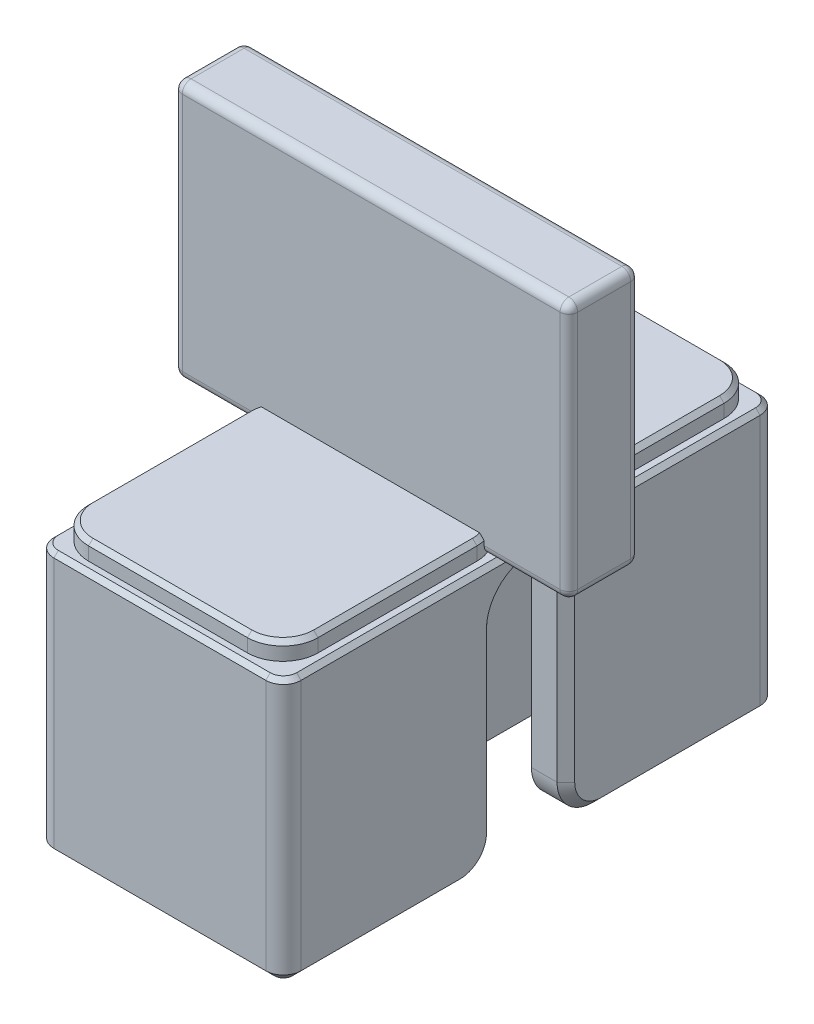
from build123d import *

# Parameters (mm, degrees)
SKETCH1_W             = 112
SKETCH1_H             = 20
BOSS_EXTRUDE1_DEPTH   = 73
FILLET1_R             = 2.5
BOSS_EXTRUDE5_DEPTH   = 5
BOSS_EXTRUDE5_2_DEPTH = 5
BOSS_EXTRUDE9_DEPTH   = 5
SKETCH10_W            = 22.5
SKETCH10_H            = 111
BOSS_EXTRUDE10_DEPTH  = 70
CUT_EXTRUDE1_DEPTH    = 70
FILLET14_R            = 10
FILLET15_R            = 10
CHAMFER1_SIZE         = 2.5
CHAMFER2_SIZE         = 1.25
CUT_EXTRUDE2_DEPTH    = 70
CUT_EXTRUDE3_DEPTH    = 70
CHAMFER3_SIZE         = 1.25


with BuildPart() as part:
    # Sketch1 → Boss-Extrude1 (new body)
    with BuildSketch(Plane(origin=(0, 0, 0), x_dir=(1, 0, 0), z_dir=(0, 1, 0))):
        Rectangle(SKETCH1_W, SKETCH1_H)
    extrude(amount=BOSS_EXTRUDE1_DEPTH)

    # Fillet1
    fillet1_edges = [part.edges().sort_by_distance(p)[0] for p in [
        (-56, 73, 0),
        (0, 73, 10),
        (56, 73, 0),
        (0, 0, 10),
        (-56, 0, 0),
        (0, 0, -10),
        (56, 0, 0),
        (56, 36.5, 10),
        (-56, 36.5, 10),
        (-56, 36.5, -10),
        (56, 36.5, -10),
        (0, 73, -10),
    ]]
    fillet(fillet1_edges, radius=FILLET1_R)


with BuildPart() as body_2:
    # Sketch7 → Boss-Extrude5 (new body)
    with BuildSketch(Plane(origin=(0, 0, 0), x_dir=(1, 0, 0), z_dir=(0, 1, 0))):
        with BuildLine():
            Line((32.297324425, -57.33785954), (32.297324425, -12.33785954))
            ThreePointArc((32.297324425, -12.33785954), (29.368392237, -5.266791728), (22.297324425, -2.33785954))
            Line((22.297324425, -2.33785954), (-22.702675575, -2.33785954))
            ThreePointArc((-22.702675575, -2.33785954), (-29.773743387, -5.266791728), (-32.702675575, -12.33785954))
            Line((-32.702675575, -12.33785954), (-32.702675575, -57.33785954))
            ThreePointArc((-32.702675575, -57.33785954), (-29.773743387, -64.408927352), (-22.702675575, -67.33785954))
            Line((-22.702675575, -67.33785954), (22.297324425, -67.33785954))
            ThreePointArc((22.297324425, -67.33785954), (29.368392237, -64.408927352), (32.297324425, -57.33785954))
        make_face()
    extrude(amount=BOSS_EXTRUDE5_DEPTH)


with BuildPart() as body_3:
    # Sketch7 → Boss-Extrude5 2 (new body)
    with BuildSketch(Plane(origin=(0, 0, 0), x_dir=(1, 0, 0), z_dir=(0, 1, 0))):
        with BuildLine():
            Line((-32.702675575, 57.66214046), (-32.702675575, 12.66214046))
            ThreePointArc((-32.702675575, 12.66214046), (-29.773743387, 5.591072648), (-22.702675575, 2.66214046))
            Line((-22.702675575, 2.66214046), (22.297324425, 2.66214046))
            ThreePointArc((22.297324425, 2.66214046), (29.368392237, 5.591072648), (32.297324425, 12.66214046))
            Line((32.297324425, 12.66214046), (32.297324425, 57.66214046))
            ThreePointArc((32.297324425, 57.66214046), (29.368392237, 64.733208272), (22.297324425, 67.66214046))
            Line((22.297324425, 67.66214046), (-22.702675575, 67.66214046))
            ThreePointArc((-22.702675575, 67.66214046), (-29.773743387, 64.733208272), (-32.702675575, 57.66214046))
        make_face()
    extrude(amount=BOSS_EXTRUDE5_2_DEPTH)


    add(body_2.part)  # Boss-Extrude9 merges body 2
    # Sketch9 → Boss-Extrude9 (add)
    with BuildSketch(Plane.XZ):
        with BuildLine():
            Line((-29.633608546, 70.217237559), (30.366391454, 70.217237559))
            ThreePointArc((30.366391454, 70.217237559), (33.90192536, 68.752771465), (35.366391454, 65.217237559))
            Line((35.366391454, 65.217237559), (35.366391454, -64.782762441))
            ThreePointArc((35.366391454, -64.782762441), (33.90192536, -68.318296346), (30.366391454, -69.782762441))
            Line((30.366391454, -69.782762441), (-29.633608546, -69.782762441))
            ThreePointArc((-29.633608546, -69.782762441), (-33.169142452, -68.318296346), (-34.633608546, -64.782762441))
            Line((-34.633608546, -64.782762441), (-34.633608546, 65.217237559))
            ThreePointArc((-34.633608546, 65.217237559), (-33.169142452, 68.752771465), (-29.633608546, 70.217237559))
        make_face()
    extrude(amount=BOSS_EXTRUDE9_DEPTH)

    # Sketch10 → Boss-Extrude10 (add)
    with BuildSketch(Plane.XZ.offset(5)):
        with BuildLine():
            Line((-34.633608546, 65.217237559), (-34.633608546, -64.782762441))
            ThreePointArc((-34.633608546, -64.782762441), (-33.169142452, -68.318296346), (-29.633608546, -69.782762441))
            Line((-29.633608546, -69.782762441), (30.366391454, -69.782762441))
            ThreePointArc((30.366391454, -69.782762441), (33.90192536, -68.318296346), (35.366391454, -64.782762441))
            Line((35.366391454, -64.782762441), (35.366391454, 65.217237559))
            ThreePointArc((35.366391454, 65.217237559), (33.90192536, 68.752771465), (30.366391454, 70.217237559))
            Line((30.366391454, 70.217237559), (-29.633608546, 70.217237559))
            ThreePointArc((-29.633608546, 70.217237559), (-33.169142452, 68.752771465), (-34.633608546, 65.217237559))
        make_face()
        with Locations((14.116391454, 0)):
            Rectangle(SKETCH10_W, SKETCH10_H, mode=Mode.SUBTRACT)
        with Locations((-14.116391454, 0)):
            Rectangle(SKETCH10_W, SKETCH10_H, mode=Mode.SUBTRACT)
    extrude(amount=BOSS_EXTRUDE10_DEPTH)

    # Sketch11 → Cut-Extrude1 (cut)
    with BuildSketch(Plane.ZY.offset(34.633608546)):
        Polygon((0.217237559, -5), (-9.782762441, -5), (-9.782762441, -75), (10.217237559, -75), (10.217237559, -5), align=None)
    extrude(amount=-CUT_EXTRUDE1_DEPTH, mode=Mode.SUBTRACT)

    # Fillet14
    fillet14_edges = [body_3.edges().sort_by_distance(p)[0] for p in [
        (-30, -5, 10.217237559),
        (-30, -5, -9.782762441),
        (0, -5, -9.782762441),
        (0, -5, 10.217237559),
        (30.366391454, -5, 10.217237559),
        (30.366391454, -5, -9.782762441),
    ]]
    fillet(fillet14_edges, radius=FILLET14_R - 0.0001)  # a hair under: the kernel refuses the full size

    # Fillet15
    fillet15_edges = [body_3.edges().sort_by_distance(p)[0] for p in [
        (0, -75, 10.217237559),
        (30.366391454, -75, 10.217237559),
        (-30, -75, 10.217237559),
        (0, -75, -9.782762441),
        (30.366391454, -75, -9.782762441),
        (-30, -75, -9.782762441),
    ]]
    fillet(fillet15_edges, radius=FILLET15_R)

    # Chamfer1
    chamfer1_edges = [body_3.edges().sort_by_distance(p)[0] for p in [
        (-34.633608546, -39.99995, -9.782762441),
        (35.366391454, -39.99995, -9.782762441),
        (-34.633608546, -7.928902899, 7.288334661),
        (-34.633608546, -7.928902899, -6.853859542),
        (35.366391454, -7.928902899, 7.288334661),
        (35.366391454, -7.928902899, -6.853859542),
        (35.366391454, -39.99995, 10.217237559),
        (35.366391454, -75, 42.717237559),
        (35.366391454, -72.071067812, -12.711694629),
        (35.366391454, -72.071067812, 13.146169748),
        (-34.633608546, -39.99995, 10.217237559),
        (-34.633608546, -75, -42.282762441),
        (-34.633608546, -72.071067812, -12.711694629),
        (-34.633608546, -72.071067812, 13.146169748),
        (-34.633608546, -75, 42.717237559),
        (-33.169142452, -75, -68.318296346),
        (0.366391454, -75, -69.782762441),
        (33.90192536, -75, -68.318296346),
        (35.366391454, -75, -42.282762441),
        (33.90192536, -75, 68.752771465),
        (0.366391454, -75, 70.217237559),
        (-33.169142452, -75, 68.752771465),
    ]]
    chamfer(chamfer1_edges, length=CHAMFER1_SIZE)

    # Chamfer2
    chamfer2_edges = [body_3.edges().sort_by_distance(p)[0] for p in [
        (-29.773743387, 5, -5.591072648),
        (-0.202675575, 5, -2.66214046),
        (29.368392237, 5, -5.591072648),
        (32.297324425, 5, -35.16214046),
        (29.368392237, 5, -64.733208272),
        (-0.202675575, 5, -67.66214046),
        (-29.773743387, 5, -64.733208272),
        (-32.702675575, 5, -35.16214046),
        (32.297324425, 5, 34.83785954),
        (29.368392237, 5, 5.266791728),
        (-0.202675575, 5, 2.33785954),
        (-29.773743387, 5, 5.266791728),
        (-32.702675575, 5, 34.83785954),
        (-29.773743387, 5, 64.408927352),
        (-0.202675575, 5, 67.33785954),
        (29.368392237, 5, 64.408927352),
    ]]
    chamfer(chamfer2_edges, length=CHAMFER2_SIZE)

    # Sketch12 → Cut-Extrude2 (cut)
    with BuildSketch(Plane.XZ.offset(75)):
        Polygon((-2.616391454, -19.782762441), (-2.616391454, -9.782762441), (-2.616391454, 0.217237559), (-2.616391454, 55.75), (-25.616391454, 55.75), (-25.616391454, 0.217237559), (-25.616391454, -55.75), (-2.616391454, -55.75), align=None)
    extrude(amount=-CUT_EXTRUDE2_DEPTH, mode=Mode.SUBTRACT)

    # Sketch13 → Cut-Extrude3 (cut)
    with BuildSketch(Plane.XZ.offset(75)):
        Polygon((25.616391454, 55.5), (2.616391454, 55.5), (2.616391454, 0.217237559), (2.616391454, -9.782762441), (2.616391454, -19.782762441), (2.866391454, -19.782762441), (2.866391454, -55.5), (25.366391454, -55.5), (25.366391454, -19.782762441), (25.616391454, -19.782762441), (25.616391454, -9.782762441), (25.616391454, 0.217237559), (25.616391454, 10.217237559), (25.616391454, 20.217237559), align=None)
    extrude(amount=-CUT_EXTRUDE3_DEPTH, mode=Mode.SUBTRACT)

    # Chamfer3
    chamfer3_edges = [body_3.edges().sort_by_distance(p)[0] for p in [
        (-33.169142452, 0, -68.318296346),
        (0.366391454, 0, -69.782762441),
        (33.90192536, 0, -68.318296346),
        (35.366391454, 0, 0.217237559),
        (33.90192536, 0, 68.752771465),
        (0.366391454, 0, 70.217237559),
        (-33.169142452, 0, 68.752771465),
        (-34.633608546, 0, 0.217237559),
    ]]
    chamfer(chamfer3_edges, length=CHAMFER3_SIZE)


solid = Compound([part.part, body_3.part])
